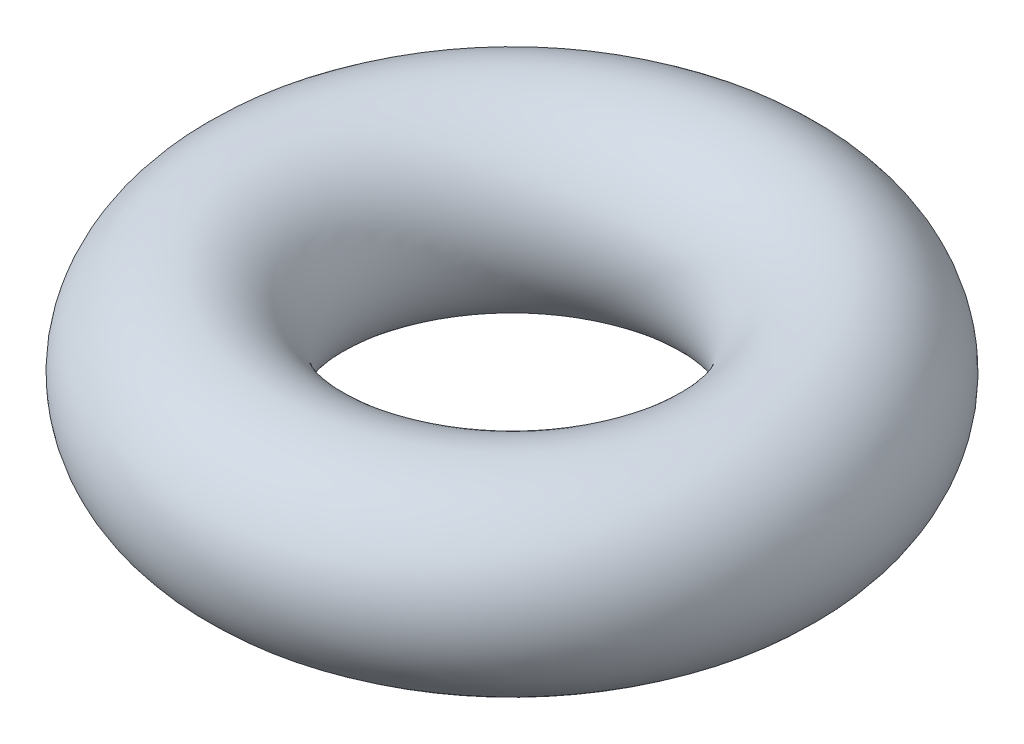
from build123d import *

# Parameters (mm, degrees)
SKETCH1_R = 25.4


with BuildPart() as part:
    # Sketch1 → Revolve1 (revolve)
    with BuildSketch(Plane.XY):
        with Locations((63.5, 0)):
            Circle(SKETCH1_R)
    revolve(axis=Axis((0, 25.4, 0), (0, -1, 0)))


solid = part.part
